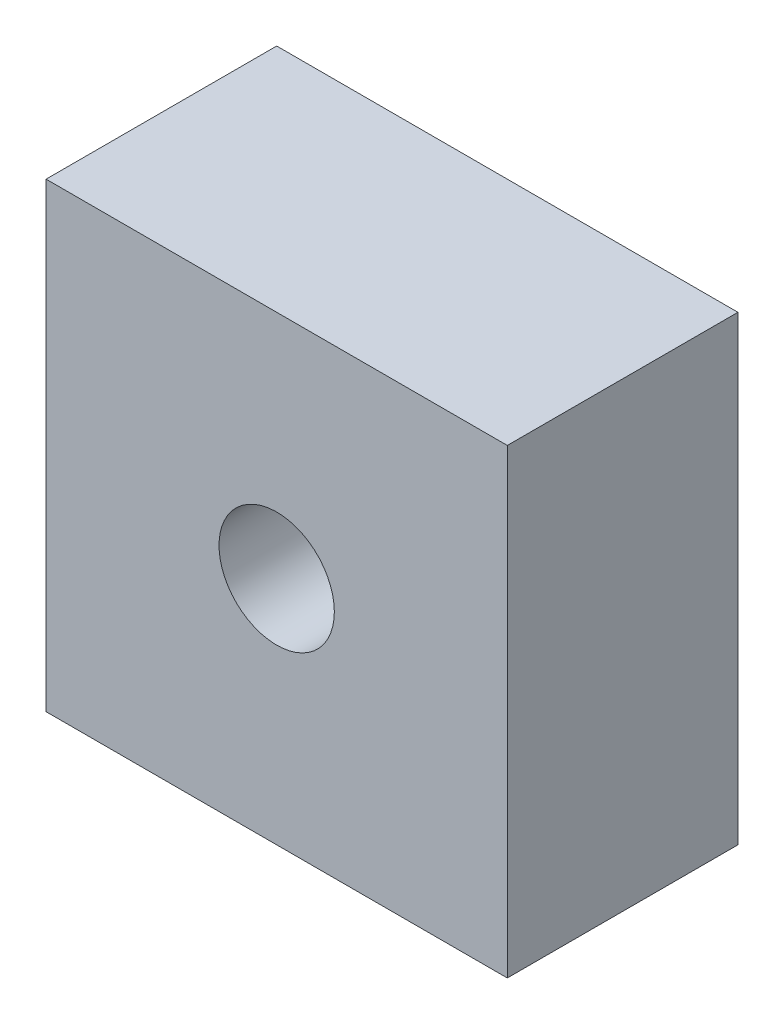
from build123d import *

# Parameters (mm, degrees)
SKETCH1_W           = 12.7
SKETCH1_H           = 12.7
SKETCH1_R           = 1.5875
BOSS_EXTRUDE1_DEPTH = 6.35


with BuildPart() as part:
    # Sketch1 → Boss-Extrude1 (new body)
    with BuildSketch(Plane.XY):
        Rectangle(SKETCH1_W, SKETCH1_H)
        Circle(SKETCH1_R, mode=Mode.SUBTRACT)
    extrude(amount=BOSS_EXTRUDE1_DEPTH)


solid = part.part
